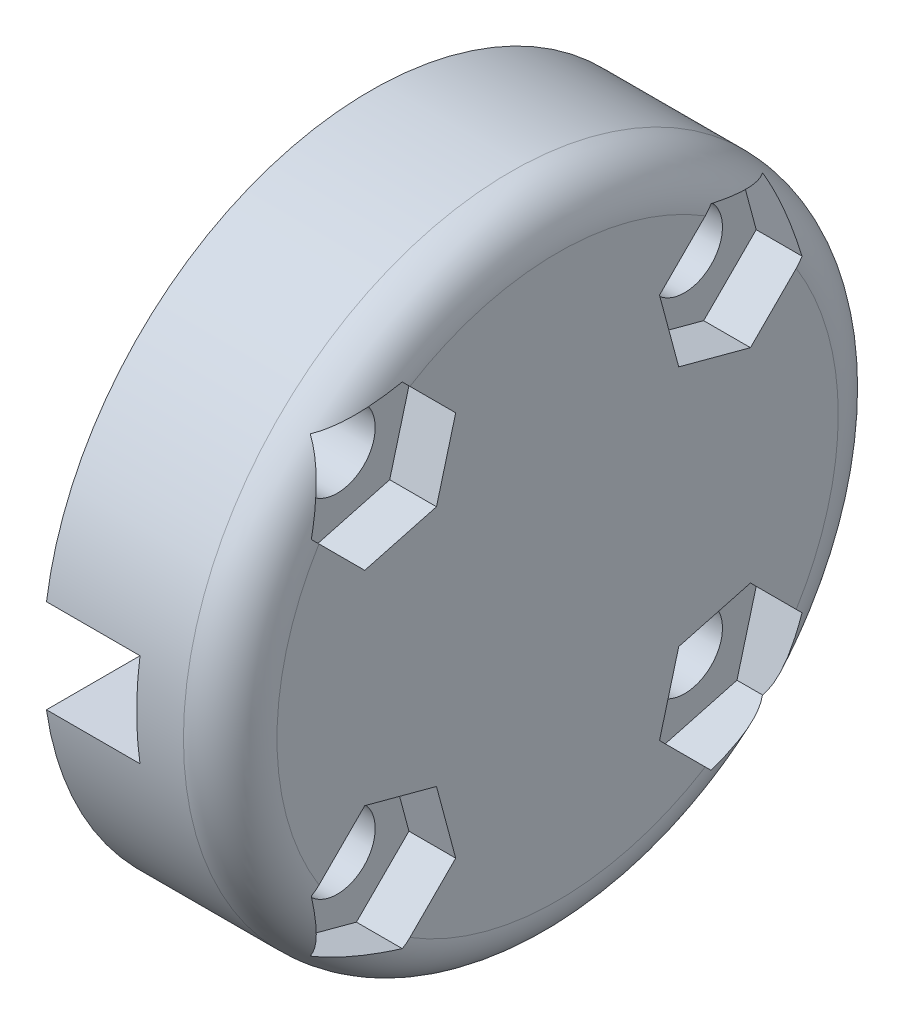
from build123d import *

# Parameters (mm, degrees)
SKETCH4_R               = 14
SKETCH4_R_2             = 1.625
CIRCULAR_FOOT_DEPTH     = 8
FILLET1_R               = 2
CUT_EXTRUDE1_DEPTH      = 2
CUT_EXTRUDE2_DEPTH      = 22.354156673
CUT_EXTRUDE2_DEPTH_BACK = 22.354156673
SKETCH14_W              = 4
SKETCH14_H              = 4
SKETCH16_R              = 2.625
CUT_EXTRUDE3_DEPTH      = 5


with BuildPart() as part:
    # Sketch4 → Circular Foot (new body)
    with BuildSketch(Plane(origin=(0, 0, 0), x_dir=(0, 0, -1), z_dir=(1, 0, 0))):
        Circle(SKETCH4_R)
        with Locations((-7.424621202, -7.424621202)):
            Circle(SKETCH4_R_2, mode=Mode.SUBTRACT)
        with Locations((7.424621202, -7.424621202)):
            Circle(SKETCH4_R_2, mode=Mode.SUBTRACT)
        with Locations((7.424621202, 7.424621202)):
            Circle(SKETCH4_R_2, mode=Mode.SUBTRACT)
        with Locations((-7.424621202, 7.424621202)):
            Circle(SKETCH4_R_2, mode=Mode.SUBTRACT)
    extrude(amount=CIRCULAR_FOOT_DEPTH)

    # Fillet1
    # the kernel refuses this fillet: 2 mm, written as the material it takes off along each edge
    with BuildSketch(Plane(origin=(8, 0, 0), x_dir=(0, 0, -1), z_dir=(0, -1, 0))) as fillet1_piece_1:
        with BuildLine():
            CenterArc((14 - FILLET1_R, -FILLET1_R), FILLET1_R, 0, 90)
            Line((14 - FILLET1_R, 0), (14, 0))
            Line((14, 0), (14, -FILLET1_R))
        make_face()
    revolve(axis=Axis((8, 0, 0), (1, 0, 0)), mode=Mode.SUBTRACT)

    # Sketch7 → Cut-Extrude1 (cut)
    with BuildSketch(Plane.ZY.offset(-8)):
        Polygon((-5.179255605, -5.179255605), (-8.246482052, -4.357394755), (-10.491847649, -6.602760353), (-9.6699868, -9.6699868), (-6.602760353, -10.491847649), (-4.357394755, -8.246482052), align=None)
        Polygon((6.602760353, -10.491847649), (9.6699868, -9.6699868), (10.491847649, -6.602760353), (8.246482052, -4.357394755), (5.179255605, -5.179255605), (4.357394755, -8.246482052), align=None)
        Polygon((6.602760353, 10.491847649), (4.357394755, 8.246482052), (5.179255605, 5.179255605), (8.246482052, 4.357394755), (10.491847649, 6.602760353), (9.6699868, 9.6699868), align=None)
        Polygon((-4.357394755, 8.246482052), (-6.602760353, 10.491847649), (-9.6699868, 9.6699868), (-10.491847649, 6.602760353), (-8.246482052, 4.357394755), (-5.179255605, 5.179255605), align=None)
    extrude(amount=CUT_EXTRUDE1_DEPTH, mode=Mode.SUBTRACT)

    # Sketch14 → Cut-Extrude2 (cut, two sides: drawn at the far end of the back side and taken through both)
    with BuildSketch(Plane.XY.offset(-CUT_EXTRUDE2_DEPTH_BACK)):
        with Locations((2, 0)):
            Rectangle(SKETCH14_W, SKETCH14_H)
    extrude(amount=CUT_EXTRUDE2_DEPTH + CUT_EXTRUDE2_DEPTH_BACK, mode=Mode.SUBTRACT)

    # Sketch16 → Cut-Extrude3 (cut)
    with BuildSketch(Plane(origin=(0, 0, 0), x_dir=(0, 0, -1), z_dir=(1, 0, 0))):
        with Locations(Location((0, 0, 0), (0, 0, 229.632406456))):
            Circle(SKETCH16_R)
    extrude(amount=CUT_EXTRUDE3_DEPTH, mode=Mode.SUBTRACT)


solid = part.part
